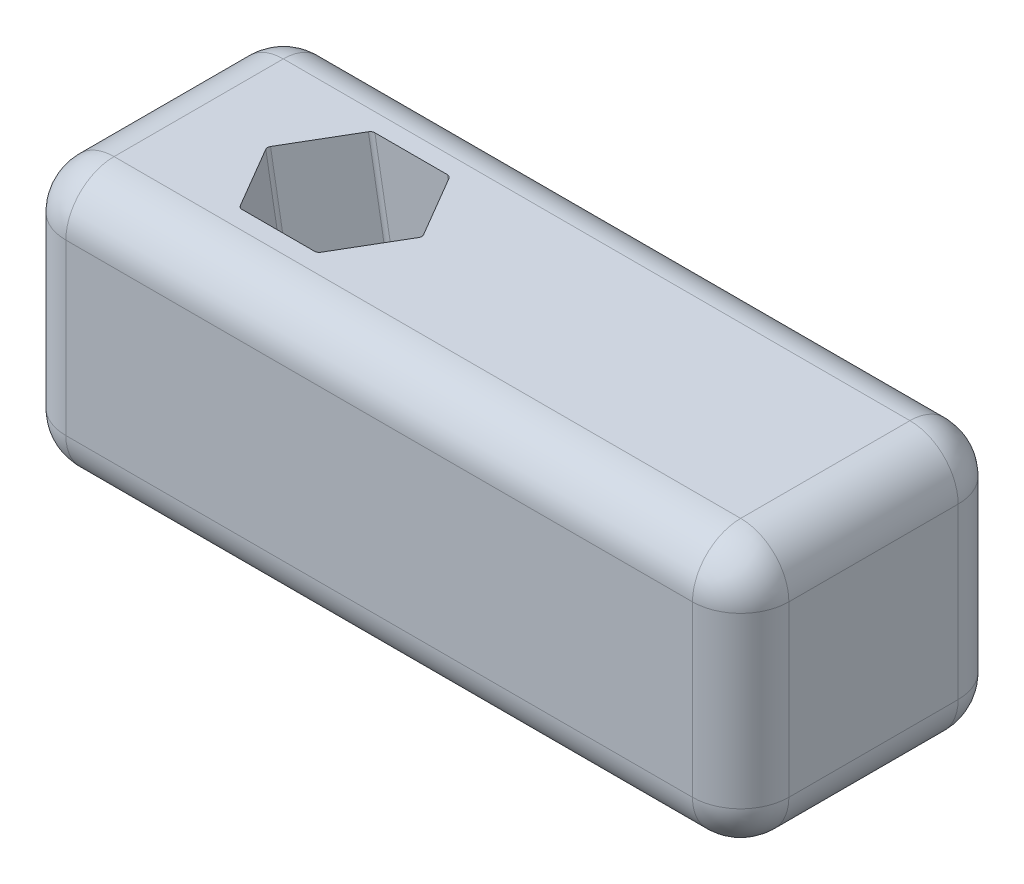
from build123d import *

# Parameters (mm, degrees)
SKETCH1_W           = 38.1
SKETCH1_H           = 14
BOSS_EXTRUDE1_DEPTH = 7
FILLET1_R           = 2.54
CUT_EXTRUDE1_DEPTH  = 12.7
FILLET2_R           = 1
FILLET3_R           = 0.25


with BuildPart() as part:
    # Sketch1 → Boss-Extrude1 (new, symmetric)
    with BuildSketch(Plane.XY):
        with Locations((19.05, 7)):
            Rectangle(SKETCH1_W, SKETCH1_H)
    extrude(amount=BOSS_EXTRUDE1_DEPTH, both=True)

    # Fillet1
    fillet1_edges = [part.edges().sort_by_distance(p)[0] for p in [
        (19.05, 0, -7),
        (38.1, 7, -7),
        (19.05, 14, -7),
        (0, 7, -7),
        (19.05, 14, 7),
        (38.1, 7, 7),
        (19.05, 0, 7),
        (0, 7, 7),
        (0, 0, 0),
        (0, 14, 0),
        (38.1, 0, 0),
        (38.1, 14, 0),
    ]]
    fillet(fillet1_edges, radius=FILLET1_R)

    # Sketch3 → Cut-Extrude1 (cut)
    with BuildSketch(Plane(origin=(-2.317550632, 13.143482763, 0), x_dir=(0.9848077530122074, 0.1736481776669347, 0), z_dir=(-0.17364817766693472, 0.9848077530122075, 0))):
        Polygon((16.548510348, 0), (14.527784405, 3.5), (10.486332521, 3.5), (8.465606579, 0), (10.486332521, -3.5), (14.527784405, -3.5), align=None)
    extrude(amount=-CUT_EXTRUDE1_DEPTH, mode=Mode.SUBTRACT)

    # Fillet2
    fillet2_edges = [part.edges().sort_by_distance(p)[0] for p in [
        (12.204829367, 2.80825221, 3.5),
        (9.219789505, 2.281909144, 1.75),
        (9.219789505, 2.281909144, -1.75),
        (12.204829367, 2.80825221, -3.5),
        (15.189869229, 3.334595276, -1.75),
        (15.189869229, 3.334595276, 1.75),
    ]]
    fillet(fillet2_edges, radius=FILLET2_R)

    # Fillet3
    fillet3_edges = [part.edges().sort_by_distance(p)[0] for p in [
        (13.96716537, 3.391251564, 3.181429078),
        (8.540483876, 2.434381201, 0),
        (10.349377707, 2.753337988, 3.181429078),
        (15.776059261, 3.71020842, 0),
        (13.96716537, 3.391251564, -3.181429078),
        (10.349377707, 2.753337988, -3.181429078),
        (13.152264465, 9.07197767, 3.5),
        (7.089376258, 8.545634604, 0),
        (9.110338994, 8.721082293, 3.5),
        (15.173227201, 9.247425359, 0),
        (13.152264465, 9.07197767, -3.5),
        (9.110338994, 8.721082293, -3.5),
    ]]
    fillet(fillet3_edges, radius=FILLET3_R)


solid = part.part
